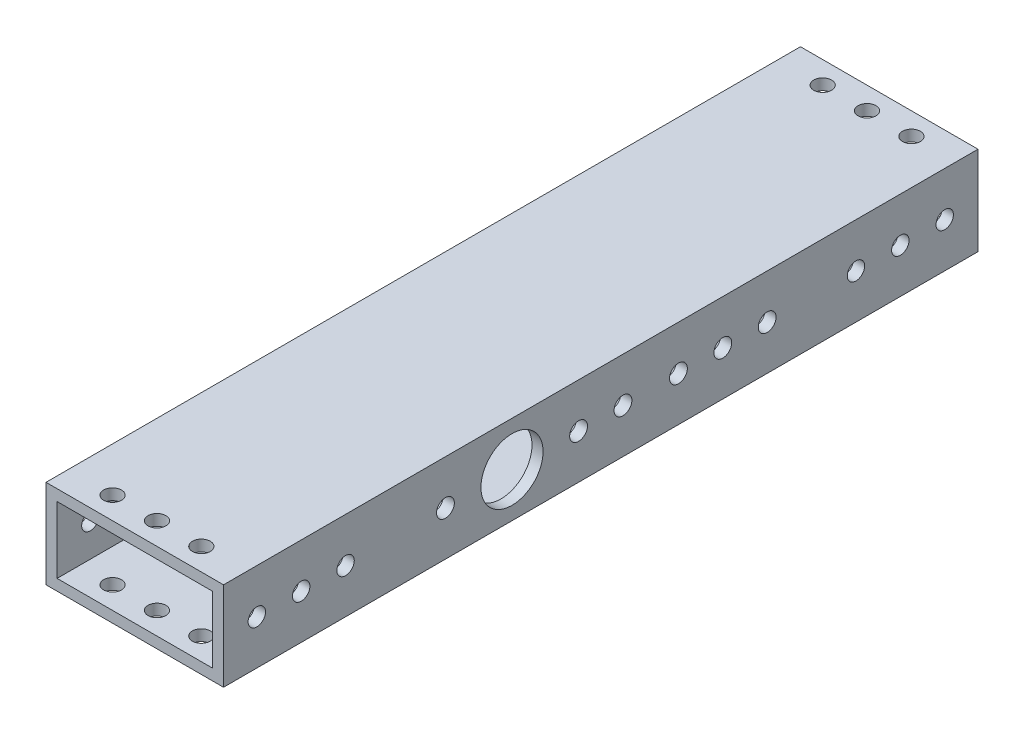
from build123d import *

# Parameters (mm, degrees)
SKETCH1_W           = 50.8
SKETCH1_H           = 25.4
SKETCH1_W_2         = 44.45
SKETCH1_H_2         = 19.05
BOSS_EXTRUDE1_DEPTH = 107.95
SKETCH3_R           = 2.5527
CUT_EXTRUDE2_DEPTH  = 114.769602707
SKETCH4_R           = 8.89
SKETCH4_R_2         = 2.5527
CUT_EXTRUDE3_DEPTH  = 120.979717036
SKETCH2_R           = 2.4892
CUT_EXTRUDE1_DEPTH  = 120.979717036
CUT_EXTRUDE4_REACH  = 115.77
SKETCH5_R           = 2.4892
CUT_EXTRUDE5_REACH  = 121.98
SKETCH7_R           = 2.5527


with BuildPart() as part:
    # Sketch1 → Boss-Extrude1 (new, symmetric)
    with BuildSketch(Plane.XY):
        Rectangle(SKETCH1_W, SKETCH1_H)
        Rectangle(SKETCH1_W_2, SKETCH1_H_2, mode=Mode.SUBTRACT)
    extrude(amount=BOSS_EXTRUDE1_DEPTH, both=True)

    # Sketch3 → Cut-Extrude2 (cut, through all)
    with BuildSketch(Plane(origin=(0, 12.7, 0), x_dir=(1, 0, 0), z_dir=(0, 1, 0))):
        with Locations((-12.7, -101.6)):
            Circle(SKETCH3_R)
        with Locations((0, -101.6)):
            Circle(SKETCH3_R)
        with Locations((12.7, -101.6)):
            Circle(SKETCH3_R)
        with Locations((12.7, 101.6)):
            Circle(SKETCH3_R)
        with Locations((0, 101.6)):
            Circle(SKETCH3_R)
        with Locations((-12.7, 101.6)):
            Circle(SKETCH3_R)
    extrude(amount=-CUT_EXTRUDE2_DEPTH, mode=Mode.SUBTRACT)

    # Sketch4 → Cut-Extrude3 (cut, through all)
    with BuildSketch(Plane(origin=(25.4, 0, 0), x_dir=(0, 0, -1), z_dir=(1, 0, 0))):
        with Locations((-25.4, 0)):
            Circle(SKETCH4_R)
        with Locations((34.925, 0)):
            Circle(SKETCH4_R_2)
        with Locations((22.225, 0)):
            Circle(SKETCH4_R_2)
    extrude(amount=-CUT_EXTRUDE3_DEPTH, mode=Mode.SUBTRACT)

    # Sketch2 → Cut-Extrude1 (cut, through all)
    with BuildSketch(Plane(origin=(25.4, 0, 0), x_dir=(0, 0, -1), z_dir=(1, 0, 0))):
        with Locations((-98.425, 0)):
            Circle(SKETCH2_R)
        with Locations((98.425, 0)):
            Circle(SKETCH2_R)
        with Locations((-85.725, 0)):
            Circle(SKETCH2_R)
        with Locations((-73.025, 0)):
            Circle(SKETCH2_R)
        with Locations((73.025, 0)):
            Circle(SKETCH2_R)
        with Locations((85.725, 0)):
            Circle(SKETCH2_R)
    extrude(amount=-CUT_EXTRUDE1_DEPTH, mode=Mode.SUBTRACT)

    # Sketch5 → Cut-Extrude4 (cut, up to next)
    with BuildSketch(Plane.XZ.offset(12.7), mode=Mode.PRIVATE) as cut_extrude4_sk1:
        with Locations((-3.81, 69.85)):
            Circle(SKETCH5_R)
    cut_extrude4_tool1 = extrude(cut_extrude4_sk1.sketch, amount=-CUT_EXTRUDE4_REACH, mode=Mode.PRIVATE) & part.part
    # Sketch5 → Cut-Extrude4 (cut, up to next)
    with BuildSketch(Plane.XZ.offset(12.7), mode=Mode.PRIVATE) as cut_extrude4_sk2:
        with Locations((-16.51, 69.85)):
            Circle(SKETCH5_R)
    cut_extrude4_tool2 = extrude(cut_extrude4_sk2.sketch, amount=-CUT_EXTRUDE4_REACH, mode=Mode.PRIVATE) & part.part
    # Sketch5 → Cut-Extrude4 (cut, up to next)
    with BuildSketch(Plane.XZ.offset(12.7), mode=Mode.PRIVATE) as cut_extrude4_sk3:
        with Locations((-16.51, 57.15)):
            Circle(SKETCH5_R)
    cut_extrude4_tool3 = extrude(cut_extrude4_sk3.sketch, amount=-CUT_EXTRUDE4_REACH, mode=Mode.PRIVATE) & part.part
    # Sketch5 → Cut-Extrude4 (cut, up to next)
    with BuildSketch(Plane.XZ.offset(12.7), mode=Mode.PRIVATE) as cut_extrude4_sk4:
        with Locations((-3.81, 57.15)):
            Circle(SKETCH5_R)
    cut_extrude4_tool4 = extrude(cut_extrude4_sk4.sketch, amount=-CUT_EXTRUDE4_REACH, mode=Mode.PRIVATE) & part.part
    # Sketch5 → Cut-Extrude4 (cut, up to next)
    with BuildSketch(Plane.XZ.offset(12.7), mode=Mode.PRIVATE) as cut_extrude4_sk5:
        with Locations((-3.81, -6.35)):
            Circle(SKETCH5_R)
    cut_extrude4_tool5 = extrude(cut_extrude4_sk5.sketch, amount=-CUT_EXTRUDE4_REACH, mode=Mode.PRIVATE) & part.part
    # Sketch5 → Cut-Extrude4 (cut, up to next)
    with BuildSketch(Plane.XZ.offset(12.7), mode=Mode.PRIVATE) as cut_extrude4_sk6:
        with Locations((-16.51, -6.35)):
            Circle(SKETCH5_R)
    cut_extrude4_tool6 = extrude(cut_extrude4_sk6.sketch, amount=-CUT_EXTRUDE4_REACH, mode=Mode.PRIVATE) & part.part
    # Sketch5 → Cut-Extrude4 (cut, up to next)
    with BuildSketch(Plane.XZ.offset(12.7), mode=Mode.PRIVATE) as cut_extrude4_sk7:
        with Locations((-16.51, -19.05)):
            Circle(SKETCH5_R)
    cut_extrude4_tool7 = extrude(cut_extrude4_sk7.sketch, amount=-CUT_EXTRUDE4_REACH, mode=Mode.PRIVATE) & part.part
    # Sketch5 → Cut-Extrude4 (cut, up to next)
    with BuildSketch(Plane.XZ.offset(12.7), mode=Mode.PRIVATE) as cut_extrude4_sk8:
        with Locations((-3.81, -19.05)):
            Circle(SKETCH5_R)
    cut_extrude4_tool8 = extrude(cut_extrude4_sk8.sketch, amount=-CUT_EXTRUDE4_REACH, mode=Mode.PRIVATE) & part.part
    add(cut_extrude4_tool1.solids().sort_by_distance((-3.81, -12.7, 69.85))[0], mode=Mode.SUBTRACT)
    add(cut_extrude4_tool2.solids().sort_by_distance((-16.51, -12.7, 69.85))[0], mode=Mode.SUBTRACT)
    add(cut_extrude4_tool3.solids().sort_by_distance((-16.51, -12.7, 57.15))[0], mode=Mode.SUBTRACT)
    add(cut_extrude4_tool4.solids().sort_by_distance((-3.81, -12.7, 57.15))[0], mode=Mode.SUBTRACT)
    add(cut_extrude4_tool5.solids().sort_by_distance((-3.81, -12.7, -6.35))[0], mode=Mode.SUBTRACT)
    add(cut_extrude4_tool6.solids().sort_by_distance((-16.51, -12.7, -6.35))[0], mode=Mode.SUBTRACT)
    add(cut_extrude4_tool7.solids().sort_by_distance((-16.51, -12.7, -19.05))[0], mode=Mode.SUBTRACT)
    add(cut_extrude4_tool8.solids().sort_by_distance((-3.81, -12.7, -19.05))[0], mode=Mode.SUBTRACT)

    # Sketch7 → Cut-Extrude5 (cut, up to next)
    with BuildSketch(Plane(origin=(25.4, 0, 0), x_dir=(0, 0, -1), z_dir=(1, 0, 0)), mode=Mode.PRIVATE) as cut_extrude5_sk1:
        with Locations((47.625, 0)):
            Circle(SKETCH7_R)
    cut_extrude5_tool1 = extrude(cut_extrude5_sk1.sketch, amount=-CUT_EXTRUDE5_REACH, mode=Mode.PRIVATE) & part.part
    # Sketch7 → Cut-Extrude5 (cut, up to next)
    with BuildSketch(Plane(origin=(25.4, 0, 0), x_dir=(0, 0, -1), z_dir=(1, 0, 0)), mode=Mode.PRIVATE) as cut_extrude5_sk2:
        with Locations((6.35, 0)):
            Circle(SKETCH7_R)
    cut_extrude5_tool2 = extrude(cut_extrude5_sk2.sketch, amount=-CUT_EXTRUDE5_REACH, mode=Mode.PRIVATE) & part.part
    # Sketch7 → Cut-Extrude5 (cut, up to next)
    with BuildSketch(Plane(origin=(25.4, 0, 0), x_dir=(0, 0, -1), z_dir=(1, 0, 0)), mode=Mode.PRIVATE) as cut_extrude5_sk3:
        with Locations((-6.35, 0)):
            Circle(SKETCH7_R)
    cut_extrude5_tool3 = extrude(cut_extrude5_sk3.sketch, amount=-CUT_EXTRUDE5_REACH, mode=Mode.PRIVATE) & part.part
    # Sketch7 → Cut-Extrude5 (cut, up to next)
    with BuildSketch(Plane(origin=(25.4, 0, 0), x_dir=(0, 0, -1), z_dir=(1, 0, 0)), mode=Mode.PRIVATE) as cut_extrude5_sk4:
        with Locations((-44.45, 0)):
            Circle(SKETCH7_R)
    cut_extrude5_tool4 = extrude(cut_extrude5_sk4.sketch, amount=-CUT_EXTRUDE5_REACH, mode=Mode.PRIVATE) & part.part
    add(cut_extrude5_tool1.solids().sort_by_distance((25.4, 0, -47.625))[0], mode=Mode.SUBTRACT)
    add(cut_extrude5_tool2.solids().sort_by_distance((25.4, 0, -6.35))[0], mode=Mode.SUBTRACT)
    add(cut_extrude5_tool3.solids().sort_by_distance((25.4, 0, 6.35))[0], mode=Mode.SUBTRACT)
    add(cut_extrude5_tool4.solids().sort_by_distance((25.4, 0, 44.45))[0], mode=Mode.SUBTRACT)


solid = part.part
